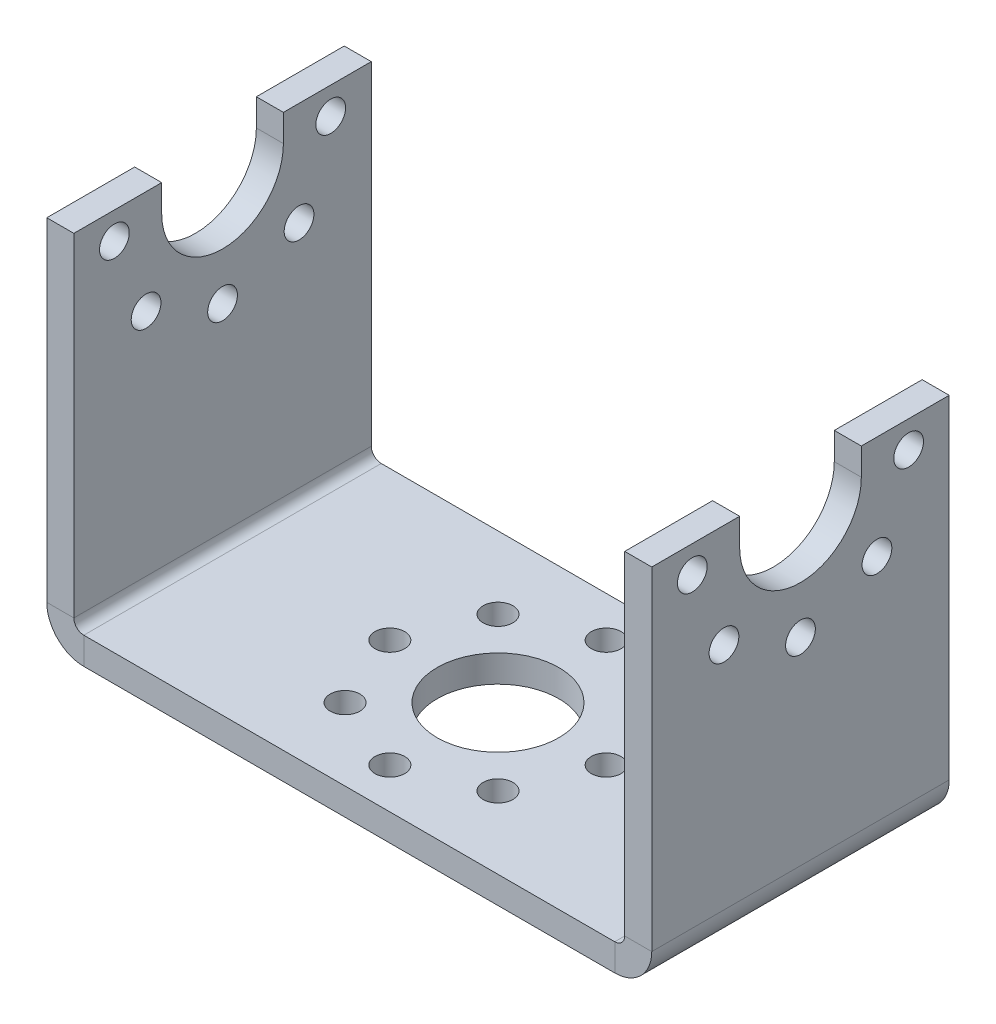
from build123d import *

# Parameters (mm, degrees)
SKETCH_1_R             = 4.5
SKETCH_1_R_2           = 1.1
SM_BASE_FLANGE_1_DEPTH = 2
OTHER_START            = -47
OTHER_1_OUTLINE_W      = 2
OTHER_1_OUTLINE_H      = 22
OTHER_1_DEPTH          = 24.627322451
OTHER_START_2          = 22.372677549
OTHER_1_2_OUTLINE_W    = 2
OTHER_1_2_OUTLINE_H    = 22
OTHER_1_2_DEPTH        = 24.627322451
OTHER_START_3          = -22.106515833
OTHER_1_3_OUTLINE_R    = 1.1
OTHER_1_3_DEPTH        = 1.733838284
OTHER_START_4          = 20.372677549
OTHER_1_4_OUTLINE_R    = 1.1
OTHER_1_4_DEPTH        = 1.733838284
OTHER_START_5          = -22.372677549
OTHER_1_5_OUTLINE_R    = 1.1
OTHER_1_5_DEPTH        = 2.7366
OTHER_START_6          = 19.636077549
OTHER_1_6_OUTLINE_R    = 1.1
OTHER_1_6_DEPTH        = 2.7366
OTHER_START_7          = -12
OTHER_1_7_DEPTH        = 24


with BuildPart() as part:
    # 基体-法兰1: sheet metal written as solids
    # Sketch 1 → 基体-法兰1 (new body)
    with BuildSketch(Plane(origin=(0, 0, 0), x_dir=(1, 0, 0), z_dir=(0, 1, 0))):
        with BuildLine():
            Line((-45, -11), (-47, -11))
            Line((-47, -11), (-47, -4.5))
            Line((-47, -4.5), (-45, -4.5))
            ThreePointArc((-45, -4.5), (-40.5, 0), (-45, 4.5))
            Line((-45, 4.5), (-47, 4.5))
            Line((-47, 4.5), (-47, 11))
            Line((-47, 11), (-45, 11))
            Line((-45, 11), (45, 11))
            Line((45, 11), (47, 11))
            Line((47, 11), (47, 4.5))
            Line((47, 4.5), (45, 4.5))
            ThreePointArc((45, 4.5), (40.5, 0), (45, -4.5))
            Line((45, -4.5), (47, -4.5))
            Line((47, -4.5), (47, -11))
            Line((47, -11), (45, -11))
            Line((45, -11), (-45, -11))
        make_face()
        with Locations(Location((0, 0, 0), (0, 0, 270))):
            Circle(SKETCH_1_R, mode=Mode.SUBTRACT)
        with Locations(Location((0, 8, 0), (0, 0, 270))):
            Circle(SKETCH_1_R_2, mode=Mode.SUBTRACT)
        with Locations(Location((5.656854249, 5.656854249, 0), (0, 0, 270))):
            Circle(SKETCH_1_R_2, mode=Mode.SUBTRACT)
        with Locations(Location((8, 0, 0), (0, 0, 270))):
            Circle(SKETCH_1_R_2, mode=Mode.SUBTRACT)
        with Locations(Location((5.656854249, -5.656854249, 0), (0, 0, 270))):
            Circle(SKETCH_1_R_2, mode=Mode.SUBTRACT)
        with Locations(Location((0, -8, 0), (0, 0, 270))):
            Circle(SKETCH_1_R_2, mode=Mode.SUBTRACT)
        with Locations(Location((-5.656854249, -5.656854249, 0), (0, 0, 270))):
            Circle(SKETCH_1_R_2, mode=Mode.SUBTRACT)
        with Locations(Location((-8, 0, 0), (0, 0, 270))):
            Circle(SKETCH_1_R_2, mode=Mode.SUBTRACT)
        with Locations(Location((-5.656854249, 5.656854249, 0), (0, 0, 270))):
            Circle(SKETCH_1_R_2, mode=Mode.SUBTRACT)
        with Locations(Location((-45, 8, 0), (0, 0, 270))):
            Circle(SKETCH_1_R_2, mode=Mode.SUBTRACT)
        with Locations(Location((-39.343145751, 5.656854249, 0), (0, 0, 270))):
            Circle(SKETCH_1_R_2, mode=Mode.SUBTRACT)
        with Locations(Location((-37, 0, 0), (0, 0, 270))):
            Circle(SKETCH_1_R_2, mode=Mode.SUBTRACT)
        with Locations(Location((-39.343145751, -5.656854249, 0), (0, 0, 270))):
            Circle(SKETCH_1_R_2, mode=Mode.SUBTRACT)
        with Locations(Location((-45, -8, 0), (0, 0, 270))):
            Circle(SKETCH_1_R_2, mode=Mode.SUBTRACT)
        with Locations(Location((45, 8, 0), (0, 0, 270))):
            Circle(SKETCH_1_R_2, mode=Mode.SUBTRACT)
        with Locations(Location((45, -8, 0), (0, 0, 270))):
            Circle(SKETCH_1_R_2, mode=Mode.SUBTRACT)
        with Locations(Location((39.343145751, -5.656854249, 0), (0, 0, 270))):
            Circle(SKETCH_1_R_2, mode=Mode.SUBTRACT)
        with Locations(Location((37, 0, 0), (0, 0, 270))):
            Circle(SKETCH_1_R_2, mode=Mode.SUBTRACT)
        with Locations(Location((39.343145751, 5.656854249, 0), (0, 0, 270))):
            Circle(SKETCH_1_R_2, mode=Mode.SUBTRACT)
    extrude(amount=-SM_BASE_FLANGE_1_DEPTH)

    # Other 1: read off the stored shape, not the designer's step
    # Other 1 outline → Other 1 (cut)
    with BuildSketch(Plane.YZ.offset(OTHER_START)):
        with Locations((-1, 0)):
            Rectangle(OTHER_1_OUTLINE_W, OTHER_1_OUTLINE_H)
    extrude(amount=OTHER_1_DEPTH, mode=Mode.SUBTRACT)

    # Other 1 2 outline → Other 1 2 (cut)
    with BuildSketch(Plane.YZ.offset(OTHER_START_2)):
        with Locations((-1, 0)):
            Rectangle(OTHER_1_2_OUTLINE_W, OTHER_1_2_OUTLINE_H)
    extrude(amount=OTHER_1_2_DEPTH, mode=Mode.SUBTRACT)

    # Other 1 3 outline → Other 1 3 (add)
    with BuildSketch(Plane.YZ.offset(OTHER_START_3)):
        with BuildLine():
            Line((0, 11), (0, -11))
            Line((0, -11), (25.372677549, -11))
            Line((25.372677549, -11), (25.372677549, -4.5))
            Line((25.372677549, -4.5), (23.372677549, -4.5))
            ThreePointArc((23.372677549, -4.5), (18.872677549, 0), (23.372677549, 4.5))
            Line((23.372677549, 4.5), (25.372677549, 4.5))
            Line((25.372677549, 4.5), (25.372677549, 11))
            Line((25.372677549, 11), (0, 11))
        make_face()
        with Locations((17.7158233, -5.656854249)):
            Circle(OTHER_1_3_OUTLINE_R, mode=Mode.SUBTRACT)
        with Locations((23.372677549, -8)):
            Circle(OTHER_1_3_OUTLINE_R, mode=Mode.SUBTRACT)
        with Locations((15.372677549, 0)):
            Circle(OTHER_1_3_OUTLINE_R, mode=Mode.SUBTRACT)
        with Locations((17.7158233, 5.656854249)):
            Circle(OTHER_1_3_OUTLINE_R, mode=Mode.SUBTRACT)
        with Locations((23.372677549, 8)):
            Circle(OTHER_1_3_OUTLINE_R, mode=Mode.SUBTRACT)
    extrude(amount=OTHER_1_3_DEPTH)

    # Other 1 4 outline → Other 1 4 (add)
    with BuildSketch(Plane.YZ.offset(OTHER_START_4)):
        with BuildLine():
            Line((0, 11), (0, -11))
            Line((0, -11), (25.372677549, -11))
            Line((25.372677549, -11), (25.372677549, -4.5))
            Line((25.372677549, -4.5), (23.372677549, -4.5))
            ThreePointArc((23.372677549, -4.5), (18.872677549, 0), (23.372677549, 4.5))
            Line((23.372677549, 4.5), (25.372677549, 4.5))
            Line((25.372677549, 4.5), (25.372677549, 11))
            Line((25.372677549, 11), (0, 11))
        make_face()
        with Locations((17.7158233, -5.656854249)):
            Circle(OTHER_1_4_OUTLINE_R, mode=Mode.SUBTRACT)
        with Locations((23.372677549, -8)):
            Circle(OTHER_1_4_OUTLINE_R, mode=Mode.SUBTRACT)
        with Locations((15.372677549, 0)):
            Circle(OTHER_1_4_OUTLINE_R, mode=Mode.SUBTRACT)
        with Locations((17.7158233, 5.656854249)):
            Circle(OTHER_1_4_OUTLINE_R, mode=Mode.SUBTRACT)
        with Locations((23.372677549, 8)):
            Circle(OTHER_1_4_OUTLINE_R, mode=Mode.SUBTRACT)
    extrude(amount=OTHER_1_4_DEPTH)

    # Other 1 5 outline → Other 1 5 (add)
    with BuildSketch(Plane.YZ.offset(OTHER_START_5)):
        with BuildLine():
            Line((0, -11), (25.372677549, -11))
            Line((25.372677549, -11), (25.372677549, -4.5))
            Line((25.372677549, -4.5), (23.372677549, -4.5))
            ThreePointArc((23.372677549, -4.5), (18.872677549, 0), (23.372677549, 4.5))
            Line((23.372677549, 4.5), (25.372677549, 4.5))
            Line((25.372677549, 4.5), (25.372677549, 11))
            Line((25.372677549, 11), (0, 11))
            Line((0, 11), (0, -11))
        make_face()
        with Locations((17.7158233, -5.656854249)):
            Circle(OTHER_1_5_OUTLINE_R, mode=Mode.SUBTRACT)
        with Locations((23.372677549, -8)):
            Circle(OTHER_1_5_OUTLINE_R, mode=Mode.SUBTRACT)
        with Locations((15.372677549, 0)):
            Circle(OTHER_1_5_OUTLINE_R, mode=Mode.SUBTRACT)
        with Locations((17.7158233, 5.656854249)):
            Circle(OTHER_1_5_OUTLINE_R, mode=Mode.SUBTRACT)
        with Locations((23.372677549, 8)):
            Circle(OTHER_1_5_OUTLINE_R, mode=Mode.SUBTRACT)
    extrude(amount=OTHER_1_5_DEPTH)

    # Other 1 6 outline → Other 1 6 (add)
    with BuildSketch(Plane.YZ.offset(OTHER_START_6)):
        with BuildLine():
            Line((0, -11), (25.372677549, -11))
            Line((25.372677549, -11), (25.372677549, -4.5))
            Line((25.372677549, -4.5), (23.372677549, -4.5))
            ThreePointArc((23.372677549, -4.5), (18.872677549, 0), (23.372677549, 4.5))
            Line((23.372677549, 4.5), (25.372677549, 4.5))
            Line((25.372677549, 4.5), (25.372677549, 11))
            Line((25.372677549, 11), (0, 11))
            Line((0, 11), (0, -11))
        make_face()
        with Locations((17.7158233, -5.656854249)):
            Circle(OTHER_1_6_OUTLINE_R, mode=Mode.SUBTRACT)
        with Locations((23.372677549, -8)):
            Circle(OTHER_1_6_OUTLINE_R, mode=Mode.SUBTRACT)
        with Locations((15.372677549, 0)):
            Circle(OTHER_1_6_OUTLINE_R, mode=Mode.SUBTRACT)
        with Locations((17.7158233, 5.656854249)):
            Circle(OTHER_1_6_OUTLINE_R, mode=Mode.SUBTRACT)
        with Locations((23.372677549, 8)):
            Circle(OTHER_1_6_OUTLINE_R, mode=Mode.SUBTRACT)
    extrude(amount=OTHER_1_6_DEPTH)

    # Other 1 7 outline → Other 1 7 (cut)
    with BuildSketch(Plane.XY.offset(OTHER_START_7)):
        with BuildLine():
            Line((-22.372677549, -2), (-19.636077549, -2))
            ThreePointArc((-19.636077549, -2), (-21.571145966, -1.198468418), (-22.372677549, 0.7366))
            Line((-22.372677549, 0.7366), (-22.372677549, -2))
        make_face()
        with BuildLine():
            Line((20.372677549, 0.7366), (20.372677549, 25.372677549))
            Line((20.372677549, 25.372677549), (19.636077549, 25.372677549))
            Line((19.636077549, 25.372677549), (19.636077549, 0))
            ThreePointArc((19.636077549, 0), (20.156932404, 0.215745145), (20.372677549, 0.7366))
        make_face()
        with BuildLine():
            ThreePointArc((22.372677549, 0.7366), (21.571145966, -1.198468418), (19.636077549, -2))
            Line((19.636077549, -2), (22.372677549, -2))
            Line((22.372677549, -2), (22.372677549, 0.7366))
        make_face()
        with BuildLine():
            Line((-19.636077549, 25.372677549), (-20.372677549, 25.372677549))
            Line((-20.372677549, 25.372677549), (-20.372677549, 0.7366))
            ThreePointArc((-20.372677549, 0.7366), (-20.156932404, 0.215745145), (-19.636077549, 0))
            Line((-19.636077549, 0), (-19.636077549, 25.372677549))
        make_face()
    extrude(amount=OTHER_1_7_DEPTH, mode=Mode.SUBTRACT)


solid = part.part
